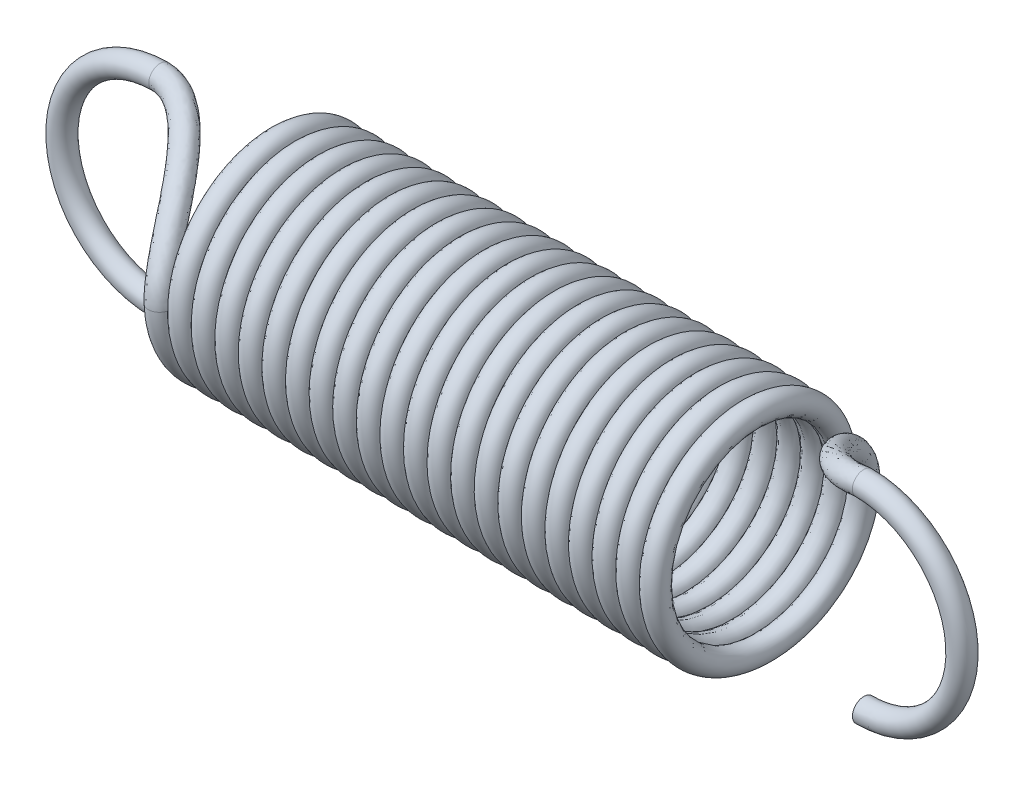
from build123d import *
from OCP.BRepAlgoAPI import BRepAlgoAPI_Cut
from OCP.TopTools import TopTools_ListOfShape

# Parameters (mm, degrees)
SWEEP1_PITCH       = 0.682846311
SWEEP1_HEIGHT      = 14.681194755
SWEEP1_RADIUS      = 2.844806766
SWEEP1_START_ANGLE = 0.00024697
SKETCH6_R          = 0.3302
SKETCH9_R          = 0.4953
CUT_EXTRUDE1_DEPTH = 0.00254


with BuildPart() as part:
    # Sweep1: sweep along a curve in space
    with BuildLine() as sweep1_path:
        ThreePointArc((10.1854, -2.8448, 0), (13.0302, 0, 0), (10.1854, 2.8448, 0))
        add(Edge.make_bspline(
            [(10.1854, 2.8448, 0), (10.106025, 2.8448, 0), (8.40286016, 2.584554109, -8e-09), (7.39817211, 1.507025702, -2.8448), (7.3406, 0, -2.8448)],
            knots=[0, 0, 0, 0, 0.05, 1, 1, 1, 1], degree=3))
        add(Helix(SWEEP1_PITCH, SWEEP1_HEIGHT, SWEEP1_RADIUS, center=(7.340597378, 1.2262e-05, 6.766e-06), direction=(-0.9999999999995752, 0, -9.217767989978329e-07), mode=Mode.PRIVATE).rotate(Axis((7.340597378, 1.2262e-05, 6.766e-06), (-0.9999999999995752, 0, -9.217767989978329e-07)), SWEEP1_START_ANGLE))
        add(Edge.make_bspline(
            [(-7.3406, 0, 2.8448), (-7.401202225, 1.586342842, 2.844891339), (-8.5979, 2.8448, 0), (-10.1854, 2.8448, 0)],
            knots=[0, 0, 0, 0, 1, 1, 1, 1], degree=3))
        ThreePointArc((-10.1854, 2.8448, 0), (-13.0302, 0, 0), (-10.1854, -2.8448, 0))
    # Sketch6 → Sweep1 (sweep)
    with BuildSketch(Plane.ZY.offset(10.1854)):
        with Locations((0, -2.8448)):
            Circle(SKETCH6_R)
    sweep(path=sweep1_path.line)


with BuildPart() as cut_extrude1_tool:
    # Sketch9 → Cut-Extrude1 (new body)
    with BuildSketch(Plane(origin=(10.185496985, -0.000347366, 0.000471989), x_dir=(3.4107944413637216e-05, 0.9999999957939931, -8.51390737044991e-05), z_dir=(-0.999999998344793, 3.4103999214992705e-05, -4.633930648757539e-05))):
        with Locations((-2.844452585, 0.000714163)):
            Circle(SKETCH9_R)
    extrude(amount=-CUT_EXTRUDE1_DEPTH)


with BuildPart() as part_1:
    add(part.part)

    # Cut-Extrude1: cut by cut_extrude1_tool, with a tolerance
    cut_extrude1_stock = TopTools_ListOfShape()
    cut_extrude1_stock.Append(part_1.part.wrapped)
    cut_extrude1_tools = TopTools_ListOfShape()
    cut_extrude1_tools.Append(cut_extrude1_tool.part.wrapped)
    cut_extrude1_cut = BRepAlgoAPI_Cut()
    cut_extrude1_cut.SetArguments(cut_extrude1_stock)
    cut_extrude1_cut.SetTools(cut_extrude1_tools)
    cut_extrude1_cut.SetFuzzyValue(0.00001)
    cut_extrude1_cut.Build()
    add(Compound.cast(cut_extrude1_cut.Shape()).solids(), mode=Mode.REPLACE)


solid = part_1.part
